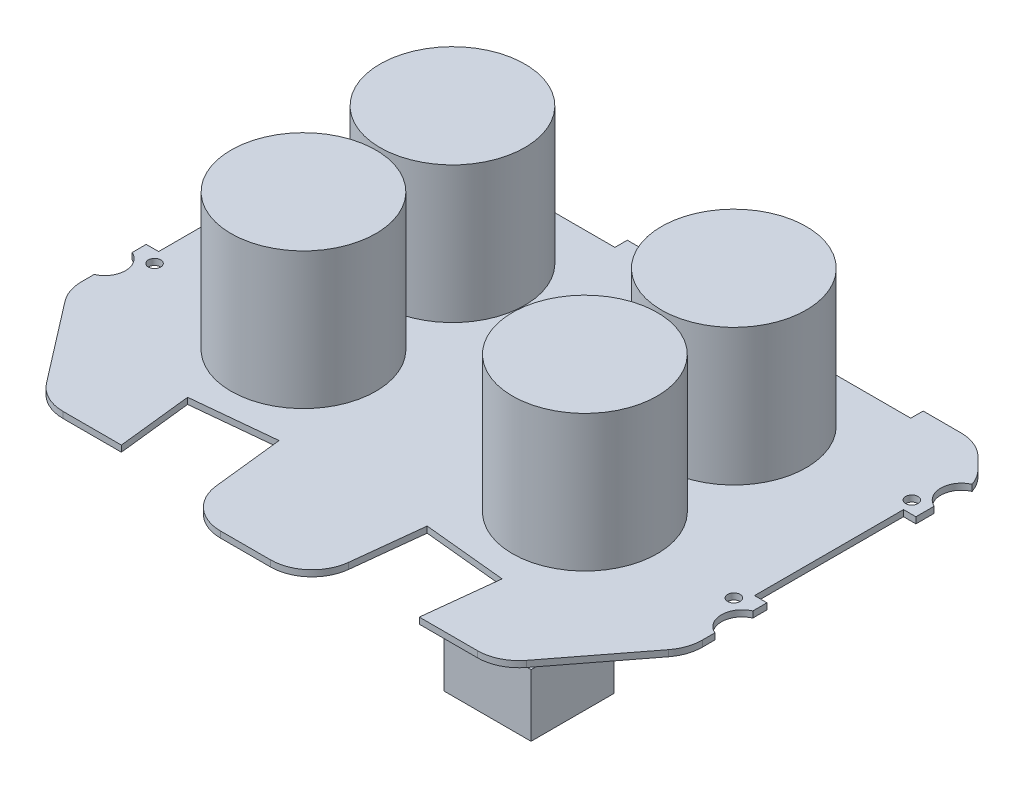
from build123d import *

# Parameters (mm, degrees)
SKETCH_2_R      = 1.5
EXTRUDE_1_DEPTH = 1.5
SKETCH_3_R      = 17.5
EXTRUDE_2_DEPTH = 33
SKETCH_4_W      = 21
SKETCH_4_H      = 20
EXTRUDE_3_DEPTH = 15
FILLET_1_R      = 10


with BuildPart() as part:
    # 草图2 → 凸台-拉伸1 (new body)
    with BuildSketch(Plane(origin=(0, 0, 0), x_dir=(1, 0, 0), z_dir=(0, 1, 0))):
        with BuildLine():
            Line((255.573084798, 167.040097328), (242.323084798, 167.040097328))
            Line((242.323084798, 167.040097328), (234.323084798, 159.040097328))
            Line((234.323084798, 159.040097328), (234.323084798, 157.622673023))
            ThreePointArc((234.323084798, 157.622673023), (236.506384931, 155.778710115), (237.323084798, 153.040097328))
            ThreePointArc((237.323084798, 153.040097328), (236.506384931, 150.30148454), (234.323084798, 148.457521633))
            Line((234.323084798, 148.457521633), (234.323084798, 144.040097328))
            Line((234.323084798, 144.040097328), (237.323084798, 144.040097328))
            Line((237.323084798, 144.040097328), (237.323084798, 108.040097328))
            Line((237.323084798, 108.040097328), (234.323084798, 108.040097328))
            Line((234.323084798, 108.040097328), (234.323084798, 104.622673023))
            ThreePointArc((234.323084798, 104.622673023), (236.506384931, 102.778710115), (237.323084798, 100.040097328))
            ThreePointArc((237.323084798, 100.040097328), (236.506384931, 97.30148454), (234.323084798, 95.457521633))
            Line((234.323084798, 95.457521633), (234.323084798, 89.040097328))
            Line((234.323084798, 89.040097328), (254.323084798, 63.040097328))
            Line((254.323084798, 63.040097328), (273.323084798, 63.040097328))
            Line((273.323084798, 63.040097328), (271.323084798, 81.040097328))
            Line((271.323084798, 81.040097328), (291.434195909, 83.040097328))
            Line((291.434195909, 83.040097328), (294.323084798, 57.040097328))
            Line((294.323084798, 57.040097328), (324.323084798, 57.040097328))
            Line((324.323084798, 57.040097328), (327.211973687, 83.040097328))
            Line((327.211973687, 83.040097328), (347.323084798, 81.040097328))
            Line((347.323084798, 81.040097328), (345.323084798, 63.040097328))
            Line((345.323084798, 63.040097328), (364.323084798, 63.040097328))
            Line((364.323084798, 63.040097328), (384.323084798, 89.040097328))
            Line((384.323084798, 89.040097328), (384.323084798, 95.457521633))
            ThreePointArc((384.323084798, 95.457521633), (381.323084798, 100.040097328), (384.323084798, 104.622673023))
            Line((384.323084798, 104.622673023), (384.323084798, 108.040097328))
            Line((384.323084798, 108.040097328), (381.323084798, 108.040097328))
            Line((381.323084798, 108.040097328), (381.323084798, 144.040097328))
            Line((381.323084798, 144.040097328), (384.323084798, 144.040097328))
            Line((384.323084798, 144.040097328), (384.323084798, 148.457521633))
            ThreePointArc((384.323084798, 148.457521633), (381.323084798, 153.040097328), (384.323084798, 157.622673023))
            Line((384.323084798, 157.622673023), (384.323084798, 159.040097328))
            Line((384.323084798, 159.040097328), (376.323084798, 167.040097328))
            Line((376.323084798, 167.040097328), (363.073084798, 167.040097328))
            Line((363.073084798, 167.040097328), (363.073084798, 164.040097328))
            Line((363.073084798, 164.040097328), (327.073084798, 164.040097328))
            Line((327.073084798, 164.040097328), (327.073084798, 167.040097328))
            Line((327.073084798, 167.040097328), (320.573084798, 167.040097328))
            Line((320.573084798, 167.040097328), (320.573084798, 164.040097328))
            Line((320.573084798, 164.040097328), (298.073084798, 164.040097328))
            Line((298.073084798, 164.040097328), (298.073084798, 167.040097328))
            Line((298.073084798, 167.040097328), (291.573084798, 167.040097328))
            Line((291.573084798, 167.040097328), (291.573084798, 164.040097328))
            Line((291.573084798, 164.040097328), (255.573084798, 164.040097328))
            Line((255.573084798, 164.040097328), (255.573084798, 167.040097328))
        make_face()
        with Locations(Location((239.323084798, 105.052003777, 0), (0, 0, 270))):
            Circle(SKETCH_2_R, mode=Mode.SUBTRACT)
        with Locations(Location((379.323084798, 105.052003777, 0), (0, 0, 270))):
            Circle(SKETCH_2_R, mode=Mode.SUBTRACT)
        with Locations(Location((238.323084798, 147.040097328, 0), (0, 0, 270))):
            Circle(SKETCH_2_R, mode=Mode.SUBTRACT)
        with Locations(Location((380.323084798, 147.040097328, 0), (0, 0, 270))):
            Circle(SKETCH_2_R, mode=Mode.SUBTRACT)
    extrude(amount=EXTRUDE_1_DEPTH)

    # 草图3 → 凸台-拉伸2 (add)
    with BuildSketch(Plane(origin=(0, 1.5, 0), x_dir=(1, 0, 0), z_dir=(0, 1, 0))):
        with Locations(Location((275.323084798, 141.040097328, 0), (0, 0, 270))):
            Circle(SKETCH_3_R)
        with Locations(Location((343.323084798, 141.040097328, 0), (0, 0, 270))):
            Circle(SKETCH_3_R)
        with Locations(Location((275.323084798, 105.040097328, 0), (0, 0, 270))):
            Circle(SKETCH_3_R)
        with Locations(Location((343.323084798, 105.040097328, 0), (0, 0, 270))):
            Circle(SKETCH_3_R)
    extrude(amount=EXTRUDE_2_DEPTH)

    # 草图4 → 凸台-拉伸3 (add)
    with BuildSketch(Plane.XZ):
        with Locations((357.823084798, -77.040097328)):
            Rectangle(SKETCH_4_W, SKETCH_4_H)
    extrude(amount=EXTRUDE_3_DEPTH)

    # 圆角1
    # the kernel refuses this fillet: 10 mm, written as the material it takes off along each edge
    with BuildSketch(Plane(origin=(234.323084798, -8.403282896, -159.040097328), x_dir=(0, 0, 1), z_dir=(0, 1, 0))) as fillet_1_piece_1:
        with BuildLine():
            CenterArc((4.694260484, 9.44787514), FILLET_1_R, 225, 25.871759313)
            Line((-2.376807328, 2.376807328), (-2.518228684, 2.235385972))
            Line((-2.518228684, 2.235385972), (-0.141421356, -0.141421356))
            Line((-0.141421356, -0.141421356), (0, -0.2))
            ThreePointArc((0, -0.2), (0.708712153, -0.2), (1.351887581, -0.188957503))
            Line((1.351887581, -0.188957503), (1.417424305, 0))
        make_face()
    extrude(amount=18.306565791, mode=Mode.SUBTRACT)
    with BuildSketch(Plane(origin=(242.323084798, -10.355339059, -167.040097328), x_dir=(-0.7071067811865476, 0, 0.7071067811865476), z_dir=(0, 1, 0)), Plane(origin=(376.323084798, -10.355339059, -167.040097328), x_dir=(-1, 0, 0), z_dir=(0, 1, 0))) as fillet_1_piece_2:
        with BuildLine():
            CenterArc((FILLET_1_R * 0.414213562373, FILLET_1_R), FILLET_1_R, 225, 45)
            Line((-FILLET_1_R * 0.292893218813, FILLET_1_R * 0.292893218813), (-FILLET_1_R * 0.307035354437, FILLET_1_R * 0.27875108319))
            Line((-FILLET_1_R * 0.307035354437, FILLET_1_R * 0.27875108319), (-FILLET_1_R * 0.00828427124746, -FILLET_1_R * 0.02))
            Line((-FILLET_1_R * 0.00828427124746, -FILLET_1_R * 0.02), (FILLET_1_R * 0.414213562373, -FILLET_1_R * 0.02))
            Line((FILLET_1_R * 0.414213562373, -FILLET_1_R * 0.02), (FILLET_1_R * 0.414213562373, 0))
        make_face()
    extrude(amount=22.210678119, mode=Mode.SUBTRACT)
    with BuildSketch(Plane(origin=(384.323084798, -8.403282896, -159.040097328), x_dir=(-0.7071067811865475, 0, -0.7071067811865475), z_dir=(0, 1, 0))) as fillet_1_piece_3:
        with BuildLine():
            CenterArc((3.361313158, 10), FILLET_1_R, 244.128240687, 25.871759313)
            Line((-1.002270338, 1.002270338), (-1.089542008, 0.822315745))
            ThreePointArc((-1.089542008, 0.822315745), (-0.642556525, 0.359713813), (-0.141421356, -0.141421356))
            Line((-0.141421356, -0.141421356), (0, -0.2))
            Line((0, -0.2), (3.361313158, -0.2))
            Line((3.361313158, -0.2), (3.361313158, 0))
        make_face()
    extrude(amount=18.306565791, mode=Mode.SUBTRACT)
    with BuildSketch(Plane(origin=(384.323084798, -8.503048667, -89.040097328), x_dir=(0, 0, -1), z_dir=(0, 1, 0)), Plane(origin=(234.323084798, -8.503048667, -89.040097328), x_dir=(0.6097107608496891, 0, 0.7926239891046025), z_dir=(0, 1, 0))) as fillet_1_piece_4:
        with BuildLine():
            CenterArc((FILLET_1_R * 0.340121946686, FILLET_1_R), FILLET_1_R, 232.431407971, 37.568592029)
            Line((-FILLET_1_R * 0.269588814164, FILLET_1_R * 0.207376010895), (-FILLET_1_R * 0.281783029381, FILLET_1_R * 0.191523531113))
            Line((-FILLET_1_R * 0.281783029381, FILLET_1_R * 0.191523531113), (-FILLET_1_R * 0.00680243893371, -FILLET_1_R * 0.02))
            Line((-FILLET_1_R * 0.00680243893371, -FILLET_1_R * 0.02), (FILLET_1_R * 0.340121946686, -FILLET_1_R * 0.02))
            Line((FILLET_1_R * 0.340121946686, -FILLET_1_R * 0.02), (FILLET_1_R * 0.340121946686, 0))
        make_face()
    extrude(amount=18.506097334, mode=Mode.SUBTRACT)
    with BuildSketch(Plane(origin=(364.323084798, -12.310037436, -63.040097328), x_dir=(0.6097107608496888, 0, -0.792623989104603), z_dir=(0, 1, 0)), Plane(origin=(254.323084798, -12.310037436, -63.040097328), x_dir=(1, 0, 0), z_dir=(0, 1, 0))) as fillet_1_piece_5:
        with BuildLine():
            CenterArc((FILLET_1_R * 0.492401497451, FILLET_1_R), FILLET_1_R, 217.568592029, 52.431407971)
            Line((-FILLET_1_R * 0.300222491654, FILLET_1_R * 0.39028923915), (-FILLET_1_R * 0.316074971436, FILLET_1_R * 0.378095023933))
            Line((-FILLET_1_R * 0.316074971436, FILLET_1_R * 0.378095023933), (-FILLET_1_R * 0.00984802994901, -FILLET_1_R * 0.02))
            Line((-FILLET_1_R * 0.00984802994901, -FILLET_1_R * 0.02), (FILLET_1_R * 0.492401497451, -FILLET_1_R * 0.02))
            Line((FILLET_1_R * 0.492401497451, -FILLET_1_R * 0.02), (FILLET_1_R * 0.492401497451, 0))
        make_face()
    extrude(amount=26.120074873, mode=Mode.SUBTRACT)
    with BuildSketch(Plane(origin=(324.323084798, -22.376069828, -57.040097328), x_dir=(0.1104315260748475, 0, -0.9938837346736189), z_dir=(0, 1, 0)), Plane(origin=(294.323084798, -22.376069828, -57.040097328), x_dir=(1, 0, 0), z_dir=(0, 1, 0))) as fillet_1_piece_6:
        with BuildLine():
            CenterArc((FILLET_1_R * 0.895042793126, FILLET_1_R), FILLET_1_R, 186.340191746, 83.659808254)
            Line((-FILLET_1_R * 0.0988409415472, FILLET_1_R * 0.889568473925), (-FILLET_1_R * 0.118718616241, FILLET_1_R * 0.887359843404))
            Line((-FILLET_1_R * 0.118718616241, FILLET_1_R * 0.887359843404), (-FILLET_1_R * 0.0179008558625, -FILLET_1_R * 0.02))
            Line((-FILLET_1_R * 0.0179008558625, -FILLET_1_R * 0.02), (FILLET_1_R * 0.895042793126, -FILLET_1_R * 0.02))
            Line((FILLET_1_R * 0.895042793126, -FILLET_1_R * 0.02), (FILLET_1_R * 0.895042793126, 0))
        make_face()
    extrude(amount=46.252139656, mode=Mode.SUBTRACT)


solid = part.part
